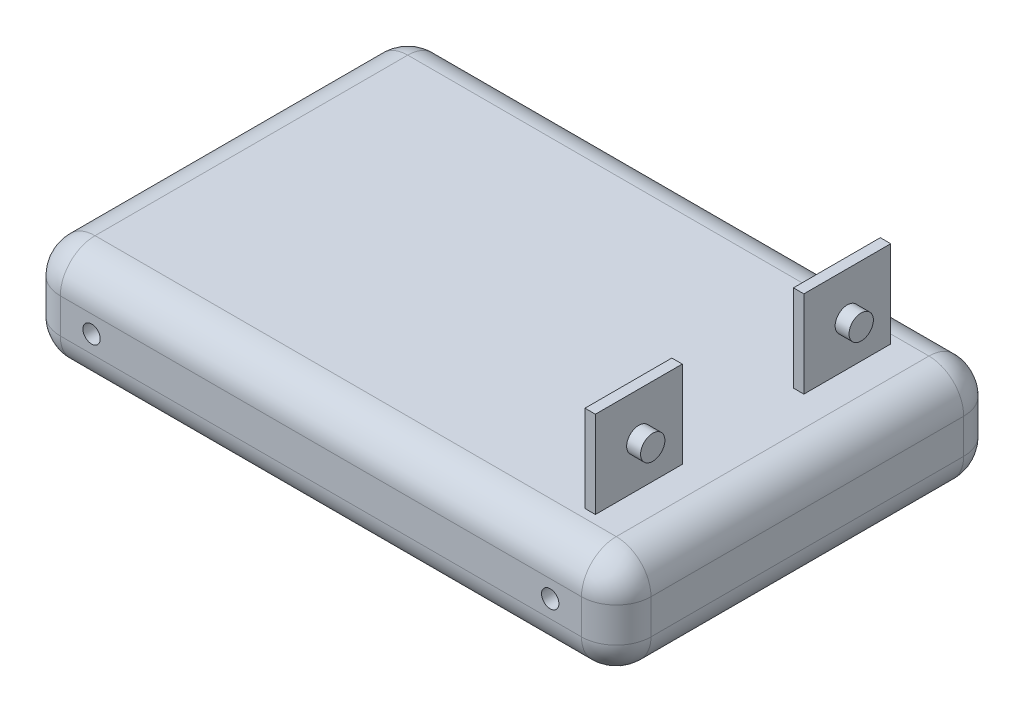
from build123d import *

# Parameters (mm, degrees)
SKETCH1_W           = 170
SKETCH1_H           = 110
BOSS_EXTRUDE1_DEPTH = 30
FILLET2_R           = 10
FILLET3_R           = 10
FILLET4_R           = 10
SKETCH3_R           = 2.5
CUT_EXTRUDE1_DEPTH  = 5
CUT_EXTRUDE2_START  = -5
SKETCH5_R           = 2.5
CUT_EXTRUDE2_DEPTH  = 5
SKETCH6_W           = 3
SKETCH6_H           = 25
BOSS_EXTRUDE2_DEPTH = 25
SKETCH7_R           = 3.5
BOSS_EXTRUDE3_DEPTH = 4
SKETCH8_R           = 3.5
BOSS_EXTRUDE4_DEPTH = 4


with BuildPart() as part:
    # Sketch1 → Boss-Extrude1 (new body)
    with BuildSketch(Plane(origin=(0, 0, 0), x_dir=(1, 0, 0), z_dir=(0, 1, 0))):
        Rectangle(SKETCH1_W, SKETCH1_H)
    extrude(amount=BOSS_EXTRUDE1_DEPTH)

    # Fillet2
    fillet2_edges = [part.edges().sort_by_distance(p)[0] for p in [
        (-85, 30, 0),
        (0, 30, 55),
        (0, 0, 55),
        (85, 15, 55),
        (-85, 15, 55),
    ]]
    fillet(fillet2_edges, radius=FILLET2_R)

    # Fillet3
    # the kernel refuses this fillet: 10 mm, written as the material it takes off along each edge
    with BuildSketch(Plane(origin=(75, 20, 45), x_dir=(1, 0, 0), z_dir=(0, 1, 0))) as fillet3_piece_1_section:
        Polygon((0, 0), (FILLET3_R, 0), (FILLET3_R, -FILLET3_R), (0, -FILLET3_R), align=None)
    fillet3_piece_1 = extrude(amount=FILLET3_R, mode=Mode.PRIVATE)
    fillet3_piece_1 = fillet3_piece_1 - Plane(origin=(75, 20, 45), x_dir=(-0.7071067811865475, 0, -0.7071067811865475), z_dir=(0, 1, 0)) * Sphere(FILLET3_R, mode=Mode.PRIVATE)
    add(fillet3_piece_1, mode=Mode.SUBTRACT)
    with BuildSketch(Plane(origin=(75, 20, -45), x_dir=(0, 1, 0), z_dir=(0, 0, -1))) as fillet3_piece_2_section:
        Polygon((0, 0), (FILLET3_R, 0), (FILLET3_R, FILLET3_R), (0, FILLET3_R), align=None)
    fillet3_piece_2 = extrude(amount=FILLET3_R, mode=Mode.PRIVATE)
    fillet3_piece_2 = fillet3_piece_2 - Plane(origin=(75, 20, -45), x_dir=(-0.7071067811865475, -0.7071067811865475, 0), z_dir=(0, 0, -1)) * Sphere(FILLET3_R, mode=Mode.PRIVATE)
    add(fillet3_piece_2, mode=Mode.SUBTRACT)
    with BuildSketch(Plane(origin=(-85, -25, -55), x_dir=(1, 0, 0), z_dir=(0, 1, 0))) as fillet3_piece_3:
        with BuildLine():
            CenterArc((FILLET3_R, -FILLET3_R), FILLET3_R, 90, 90)
            Line((0, -FILLET3_R), (0, 0))
            Line((0, 0), (FILLET3_R, 0))
        make_face()
    extrude(amount=45, mode=Mode.SUBTRACT)
    with BuildSketch(Plane(origin=(85, 30, -45), x_dir=(-1, 0, 0), z_dir=(0, 0, 1))) as fillet3_piece_4:
        with BuildLine():
            CenterArc((FILLET3_R, FILLET3_R), FILLET3_R, 180, 90)
            Line((0, FILLET3_R), (0, 0))
            Line((0, 0), (FILLET3_R, 0))
        make_face()
    extrude(amount=90, mode=Mode.SUBTRACT)
    with BuildSketch(Plane(origin=(-75, 20, -55), x_dir=(-1, 0, 0), z_dir=(0, -1, 0))) as fillet3_piece_5:
        with BuildLine():
            CenterArc((10 - FILLET3_R, -FILLET3_R), FILLET3_R, 0, 90)
            Line((10, -FILLET3_R), (10, 0))
            Line((10, 0), (10 - FILLET3_R, 0))
        make_face()
    revolve(axis=Axis((-75, 20, -55), (0, 0, -1)), revolution_arc=90, mode=Mode.SUBTRACT)
    with BuildSketch(Plane(origin=(85, -25, -55), x_dir=(-1, 0, 0), z_dir=(0, 1, 0))) as fillet3_piece_6:
        with BuildLine():
            CenterArc((FILLET3_R, FILLET3_R), FILLET3_R, 180, 90)
            Line((0, FILLET3_R), (0, 0))
            Line((0, 0), (FILLET3_R, 0))
        make_face()
    extrude(amount=45, mode=Mode.SUBTRACT)
    with BuildSketch(Plane(origin=(-75, 30, -55), x_dir=(0, -1, 0), z_dir=(1, 0, 0))) as fillet3_piece_7:
        with BuildLine():
            CenterArc((FILLET3_R, -FILLET3_R), FILLET3_R, 90, 90)
            Line((0, -FILLET3_R), (0, 0))
            Line((0, 0), (FILLET3_R, 0))
        make_face()
    extrude(amount=150, mode=Mode.SUBTRACT)

    # Fillet4
    # the kernel refuses this fillet: 10 mm, written as the material it takes off along each edge
    with BuildSketch(Plane(origin=(75, 10, 45), x_dir=(1, 0, 0), z_dir=(0, -1, 0))) as fillet4_piece_1_section:
        Polygon((0, 0), (FILLET4_R, 0), (FILLET4_R, FILLET4_R), (0, FILLET4_R), align=None)
    fillet4_piece_1 = extrude(amount=FILLET4_R, mode=Mode.PRIVATE)
    fillet4_piece_1 = fillet4_piece_1 - Plane(origin=(75, 10, 45), x_dir=(-0.7071067811865475, 0, -0.7071067811865475), z_dir=(0, -1, 0)) * Sphere(FILLET4_R, mode=Mode.PRIVATE)
    add(fillet4_piece_1, mode=Mode.SUBTRACT)
    with BuildSketch(Plane(origin=(-75, 10, 45), x_dir=(-1, 0, 0), z_dir=(0, -1, 0))) as fillet4_piece_2_section:
        Polygon((0, 0), (FILLET4_R, 0), (FILLET4_R, -FILLET4_R), (0, -FILLET4_R), align=None)
    fillet4_piece_2 = extrude(amount=FILLET4_R, mode=Mode.PRIVATE)
    fillet4_piece_2 = fillet4_piece_2 - Plane(origin=(-75, 10, 45), x_dir=(0.7071067811865475, 0, -0.7071067811865475), z_dir=(0, -1, 0)) * Sphere(FILLET4_R, mode=Mode.PRIVATE)
    add(fillet4_piece_2, mode=Mode.SUBTRACT)
    with BuildSketch(Plane(origin=(85, 0, -45), x_dir=(-1, 0, 0), z_dir=(0, 0, 1)), Plane(origin=(-85, 0, 45), x_dir=(1, 0, 0), z_dir=(0, 0, -1))) as fillet4_piece_3:
        with BuildLine():
            CenterArc((FILLET4_R, -FILLET4_R), FILLET4_R, 90, 90)
            Line((0, -FILLET4_R), (0, 0))
            Line((0, 0), (FILLET4_R, 0))
        make_face()
    extrude(amount=90, mode=Mode.SUBTRACT)
    with BuildSketch(Plane(origin=(-75, 0, -55), x_dir=(0, 1, 0), z_dir=(1, 0, 0))) as fillet4_piece_4:
        with BuildLine():
            CenterArc((FILLET4_R, FILLET4_R), FILLET4_R, 180, 90)
            Line((0, FILLET4_R), (0, 0))
            Line((0, 0), (FILLET4_R, 0))
        make_face()
    extrude(amount=150, mode=Mode.SUBTRACT)
    with BuildSketch(Plane(origin=(75, 0, -45), x_dir=(0, 0, -1), z_dir=(-1, 0, 0))) as fillet4_piece_5:
        with BuildLine():
            CenterArc((10 - FILLET4_R, -FILLET4_R), FILLET4_R, 0, 90)
            Line((10, -FILLET4_R), (10, 0))
            Line((10, 0), (10 - FILLET4_R, 0))
        make_face()
    revolve(axis=Axis((75, 0, -45), (0, -1, 0)), revolution_arc=90, mode=Mode.SUBTRACT)
    with BuildSketch(Plane(origin=(-75, 0, -45), x_dir=(-1, 0, 0), z_dir=(0, 0, 1))) as fillet4_piece_6:
        with BuildLine():
            CenterArc((10 - FILLET4_R, -FILLET4_R), FILLET4_R, 0, 90)
            Line((10, -FILLET4_R), (10, 0))
            Line((10, 0), (10 - FILLET4_R, 0))
        make_face()
    revolve(axis=Axis((-75, 0, -45), (0, -1, 0)), revolution_arc=90, mode=Mode.SUBTRACT)

    # Sketch3 → Cut-Extrude1 (cut)
    with BuildSketch(Plane(origin=(0, 0, -55), x_dir=(-1, 0, 0), z_dir=(0, 0, -1))):
        with Locations((-66, 15)):
            Circle(SKETCH3_R)
        with Locations((66, 15)):
            Circle(SKETCH3_R)
    extrude(amount=-CUT_EXTRUDE1_DEPTH, mode=Mode.SUBTRACT)

    # Sketch5 → Cut-Extrude2 (cut)
    with BuildSketch(Plane.XY.offset(55).offset(CUT_EXTRUDE2_START)):
        with Locations(Location((-66, 15, 0), (0, 0, 180))):
            Circle(SKETCH5_R)
        with Locations(Location((66, 15, 0), (0, 0, 180))):
            Circle(SKETCH5_R)
    extrude(amount=CUT_EXTRUDE2_DEPTH, mode=Mode.SUBTRACT)

    # Sketch6 → Boss-Extrude2 (add)
    with BuildSketch(Plane(origin=(0, 30, 0), x_dir=(1, 0, 0), z_dir=(0, 1, 0))):
        with Locations((65, 30)):
            Rectangle(SKETCH6_W, SKETCH6_H)
        with Locations((65, -30)):
            Rectangle(SKETCH6_W, SKETCH6_H)
    extrude(amount=BOSS_EXTRUDE2_DEPTH)

    # Sketch7 → Boss-Extrude3 (add)
    with BuildSketch(Plane(origin=(66.5, 0, 0), x_dir=(0, 0, -1), z_dir=(1, 0, 0))):
        with Locations(Location((-30, 42.5, 0), (0, 0, 180))):
            Circle(SKETCH7_R)
    extrude(amount=BOSS_EXTRUDE3_DEPTH)

    # Sketch8 → Boss-Extrude4 (add)
    with BuildSketch(Plane(origin=(66.5, 0, 0), x_dir=(0, 0, -1), z_dir=(1, 0, 0))):
        with Locations(Location((30, 42.5, 0), (0, 0, 180))):
            Circle(SKETCH8_R)
    extrude(amount=BOSS_EXTRUDE4_DEPTH)


solid = part.part
